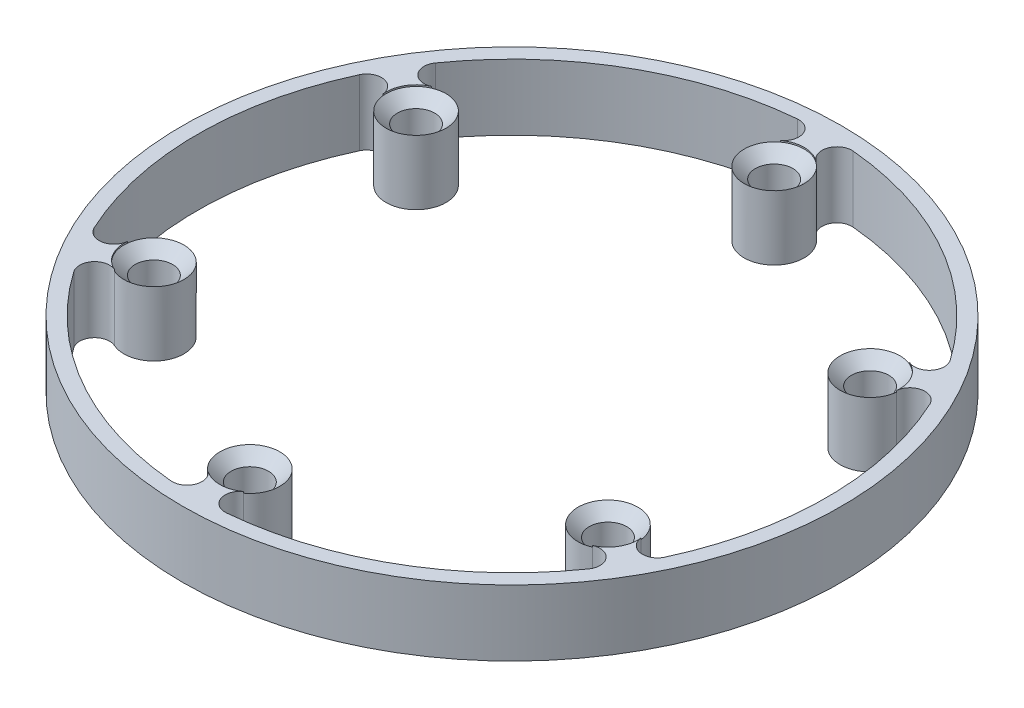
from build123d import *

# Parameters (mm, degrees)
SKETCH1_R                        = 22
BASE_SHAPE_DEPTH                 = 4.4
SPOKES_CUT_REACH                 = 33.422
SKETCH4_R                        = 1
SKETCH4_R_2                      = 2
SPOKE_FILLETS_R                  = 1
REMOVE_INNER_2_REACH             = 33.422
OUTER_M2_COUNTERSUNKS_AT_2_COUNT = 2
OUTER_M2_COUNTERSUNKS_AT_2_PITCH = 17.5
OUTER_M2_COUNTERSUNKS_AT_3_COUNT = 2
OUTER_M2_COUNTERSUNKS_AT_3_PITCH = 30.310889132
OUTER_M2_COUNTERSUNKS_AT_4_COUNT = 2
OUTER_M2_COUNTERSUNKS_AT_4_PITCH = 35
OUTER_M2_COUNTERSUNKS_AT_5_COUNT = 2
OUTER_M2_COUNTERSUNKS_AT_5_PITCH = 30.310889132
OUTER_M2_COUNTERSUNKS_AT_6_COUNT = 2
OUTER_M2_COUNTERSUNKS_AT_6_PITCH = 17.5


with BuildPart() as part:
    # Sketch1 → Base shape (new body)
    with BuildSketch(Plane(origin=(0, 0, 0), x_dir=(1, 0, 0), z_dir=(0, 1, 0))):
        Circle(SKETCH1_R)
    extrude(amount=BASE_SHAPE_DEPTH)

    # Sketch4 → Spokes cut (cut, up to next)
    with BuildSketch(Plane(origin=(0, 4.4, 0), x_dir=(1, 0, 0), z_dir=(0, 1, 0)), mode=Mode.PRIVATE) as spokes_cut_sk1:
        with BuildLine():
            Line((-0.5, 2.958039892), (-0.5, 15.563508327))
            ThreePointArc((-0.5, 15.563508327), (-1.964231018, 17.123441227), (-1.180712378, 19.114285688))
            ThreePointArc((-1.180712378, 19.114285688), (-0.835201556, 20.273782145), (-1.859621921, 20.917500001))
            ThreePointArc((-1.859621921, 20.917500001), (-10.499999965, 18.186533499), (-17.185275378, 12.069229892))
            ThreePointArc((-17.185275378, 12.069229892), (-17.140009652, 10.860196912), (-15.963100894, 10.579669712))
            ThreePointArc((-15.963100894, 10.579669712), (-13.847219636, 10.26279461), (-13.228393583, 8.214766865))
            Line((-13.228393583, 8.214766865), (-2.311737691, 1.912032648))
            ThreePointArc((-2.311737691, 1.912032648), (-1.5, 2.598076211), (-0.5, 2.958039892))
        make_face()
    spokes_cut_tool1 = extrude(spokes_cut_sk1.sketch, amount=-SPOKES_CUT_REACH, mode=Mode.PRIVATE) & part.part
    # Sketch4 → Spokes cut (cut, up to next)
    with BuildSketch(Plane(origin=(0, 4.4, 0), x_dir=(1, 0, 0), z_dir=(0, 1, 0)), mode=Mode.PRIVATE) as spokes_cut_sk2:
        with BuildLine():
            Line((0.5, 15.563508327), (0.5, 2.958039892))
            ThreePointArc((0.5, 2.958039892), (1.5, 2.598076211), (2.311737691, 1.912032648))
            Line((2.311737691, 1.912032648), (13.228393583, 8.214766865))
            ThreePointArc((13.228393583, 8.214766865), (13.847219664, 10.262794634), (15.96310096, 10.579669683))
            ThreePointArc((15.96310096, 10.579669683), (17.140009604, 10.860196854), (17.185275506, 12.06922971))
            ThreePointArc((17.185275506, 12.06922971), (10.500000061, 18.186533444), (1.859621921, 20.917500001))
            ThreePointArc((1.859621921, 20.917500001), (0.835201556, 20.273782145), (1.180712378, 19.114285688))
            ThreePointArc((1.180712378, 19.114285688), (1.964231018, 17.123441227), (0.5, 15.563508327))
        make_face()
    spokes_cut_tool2 = extrude(spokes_cut_sk2.sketch, amount=-SPOKES_CUT_REACH, mode=Mode.PRIVATE) & part.part
    # Sketch4 → Spokes cut (cut, up to next)
    with BuildSketch(Plane(origin=(0, 4.4, 0), x_dir=(1, 0, 0), z_dir=(0, 1, 0)), mode=Mode.PRIVATE) as spokes_cut_sk3:
        with BuildLine():
            ThreePointArc((-2.811737691, -1.046007244), (-3, 0), (-2.811737691, 1.046007244))
            Line((-2.811737691, 1.046007244), (-13.728393583, 7.348741462))
            ThreePointArc((-13.728393583, 7.348741462), (-15.811450636, 6.860646662), (-17.143813175, 8.534615982))
            ThreePointArc((-17.143813175, 8.534615982), (-17.975211353, 9.413585342), (-19.044897499, 8.848269844))
            ThreePointArc((-19.044897499, 8.848269844), (-21, 0), (-19.044897499, -8.848269844))
            ThreePointArc((-19.044897499, -8.848269844), (-17.975211396, -9.413585349), (-17.143813185, -8.534616069))
            ThreePointArc((-17.143813185, -8.534616069), (-15.811450677, -6.860646676), (-13.728393583, -7.348741462))
            Line((-13.728393583, -7.348741462), (-2.811737691, -1.046007244))
        make_face()
    spokes_cut_tool3 = extrude(spokes_cut_sk3.sketch, amount=-SPOKES_CUT_REACH, mode=Mode.PRIVATE) & part.part
    # Sketch4 → Spokes cut (cut, up to next)
    with BuildSketch(Plane(origin=(0, 4.4, 0), x_dir=(1, 0, 0), z_dir=(0, 1, 0)), mode=Mode.PRIVATE) as spokes_cut_sk4:
        with BuildLine():
            Line((13.728393583, 7.348741462), (2.811737691, 1.046007244))
            ThreePointArc((2.811737691, 1.046007244), (3, 0), (2.811737691, -1.046007244))
            Line((2.811737691, -1.046007244), (13.728393583, -7.348741462))
            ThreePointArc((13.728393583, -7.348741462), (15.811450607, -6.860646652), (17.143813168, -8.53461592))
            ThreePointArc((17.143813168, -8.53461592), (17.975211292, -9.413585332), (19.044897474, -8.848269898))
            ThreePointArc((19.044897474, -8.848269898), (21, -4.8e-08), (19.044897515, 8.848269811))
            ThreePointArc((19.044897515, 8.848269811), (17.975211402, 9.41358535), (17.143813182, 8.534616045))
            ThreePointArc((17.143813182, 8.534616045), (15.811450666, 6.860646672), (13.728393583, 7.348741462))
        make_face()
    spokes_cut_tool4 = extrude(spokes_cut_sk4.sketch, amount=-SPOKES_CUT_REACH, mode=Mode.PRIVATE) & part.part
    # Sketch4 → Spokes cut (cut, up to next)
    with BuildSketch(Plane(origin=(0, 4.4, 0), x_dir=(1, 0, 0), z_dir=(0, 1, 0)), mode=Mode.PRIVATE) as spokes_cut_sk5:
        with BuildLine():
            ThreePointArc((-0.5, -2.958039892), (-1.5, -2.598076211), (-2.311737691, -1.912032648))
            Line((-2.311737691, -1.912032648), (-13.228393583, -8.214766865))
            ThreePointArc((-13.228393583, -8.214766865), (-13.847219645, -10.262794618), (-15.963100915, -10.579669703))
            ThreePointArc((-15.963100915, -10.579669703), (-17.140009597, -10.860196846), (-17.185275489, -12.069229733))
            ThreePointArc((-17.185275489, -12.069229733), (-10.500000091, -18.186533427), (-1.859622018, -20.917499993))
            ThreePointArc((-1.859622018, -20.917499993), (-0.835201569, -20.27378218), (-1.180712396, -19.114285674))
            ThreePointArc((-1.180712396, -19.114285674), (-1.964231015, -17.123441216), (-0.5, -15.563508327))
            Line((-0.5, -15.563508327), (-0.5, -2.958039892))
        make_face()
    spokes_cut_tool5 = extrude(spokes_cut_sk5.sketch, amount=-SPOKES_CUT_REACH, mode=Mode.PRIVATE) & part.part
    # Sketch4 → Spokes cut (cut, up to next)
    with BuildSketch(Plane(origin=(0, 4.4, 0), x_dir=(1, 0, 0), z_dir=(0, 1, 0)), mode=Mode.PRIVATE) as spokes_cut_sk6:
        with BuildLine():
            Line((13.228393583, -8.214766865), (2.311737691, -1.912032648))
            ThreePointArc((2.311737691, -1.912032648), (1.5, -2.598076211), (0.5, -2.958039892))
            Line((0.5, -2.958039892), (0.5, -15.563508327))
            ThreePointArc((0.5, -15.563508327), (1.96423102, -17.123441238), (1.18071236, -19.114285701))
            ThreePointArc((1.18071236, -19.114285701), (0.835201555, -20.273782143), (1.859621893, -20.917500004))
            ThreePointArc((1.859621893, -20.917500004), (10.499999953, -18.186533507), (17.185275378, -12.069229892))
            ThreePointArc((17.185275378, -12.069229892), (17.140009606, -10.860196857), (15.963100764, -10.57966977))
            ThreePointArc((15.963100764, -10.57966977), (13.847219583, -10.262794564), (13.228393583, -8.214766865))
        make_face()
    spokes_cut_tool6 = extrude(spokes_cut_sk6.sketch, amount=-SPOKES_CUT_REACH, mode=Mode.PRIVATE) & part.part
    # Sketch4 → Spokes cut (cut, up to next)
    with BuildSketch(Plane(origin=(0, 4.4, 0), x_dir=(1, 0, 0), z_dir=(0, 1, 0)), mode=Mode.PRIVATE) as spokes_cut_sk7:
        with Locations((0, 17.5)):
            Circle(SKETCH4_R)
    spokes_cut_tool7 = extrude(spokes_cut_sk7.sketch, amount=-SPOKES_CUT_REACH, mode=Mode.PRIVATE) & part.part
    # Sketch4 → Spokes cut (cut, up to next)
    with BuildSketch(Plane(origin=(0, 4.4, 0), x_dir=(1, 0, 0), z_dir=(0, 1, 0)), mode=Mode.PRIVATE) as spokes_cut_sk8:
        Circle(SKETCH4_R_2)
    spokes_cut_tool8 = extrude(spokes_cut_sk8.sketch, amount=-SPOKES_CUT_REACH, mode=Mode.PRIVATE) & part.part
    # Sketch4 → Spokes cut (cut, up to next)
    with BuildSketch(Plane(origin=(0, 4.4, 0), x_dir=(1, 0, 0), z_dir=(0, 1, 0)), mode=Mode.PRIVATE) as spokes_cut_sk9:
        with Locations((15.155444566, 8.75)):
            Circle(SKETCH4_R)
    spokes_cut_tool9 = extrude(spokes_cut_sk9.sketch, amount=-SPOKES_CUT_REACH, mode=Mode.PRIVATE) & part.part
    # Sketch4 → Spokes cut (cut, up to next)
    with BuildSketch(Plane(origin=(0, 4.4, 0), x_dir=(1, 0, 0), z_dir=(0, 1, 0)), mode=Mode.PRIVATE) as spokes_cut_sk10:
        with Locations((15.155444566, -8.75)):
            Circle(SKETCH4_R)
    spokes_cut_tool10 = extrude(spokes_cut_sk10.sketch, amount=-SPOKES_CUT_REACH, mode=Mode.PRIVATE) & part.part
    # Sketch4 → Spokes cut (cut, up to next)
    with BuildSketch(Plane(origin=(0, 4.4, 0), x_dir=(1, 0, 0), z_dir=(0, 1, 0)), mode=Mode.PRIVATE) as spokes_cut_sk11:
        with Locations((0, -17.5)):
            Circle(SKETCH4_R)
    spokes_cut_tool11 = extrude(spokes_cut_sk11.sketch, amount=-SPOKES_CUT_REACH, mode=Mode.PRIVATE) & part.part
    # Sketch4 → Spokes cut (cut, up to next)
    with BuildSketch(Plane(origin=(0, 4.4, 0), x_dir=(1, 0, 0), z_dir=(0, 1, 0)), mode=Mode.PRIVATE) as spokes_cut_sk12:
        with Locations((-15.155444566, -8.75)):
            Circle(SKETCH4_R)
    spokes_cut_tool12 = extrude(spokes_cut_sk12.sketch, amount=-SPOKES_CUT_REACH, mode=Mode.PRIVATE) & part.part
    # Sketch4 → Spokes cut (cut, up to next)
    with BuildSketch(Plane(origin=(0, 4.4, 0), x_dir=(1, 0, 0), z_dir=(0, 1, 0)), mode=Mode.PRIVATE) as spokes_cut_sk13:
        with Locations((-15.155444566, 8.75)):
            Circle(SKETCH4_R)
    spokes_cut_tool13 = extrude(spokes_cut_sk13.sketch, amount=-SPOKES_CUT_REACH, mode=Mode.PRIVATE) & part.part
    add(spokes_cut_tool1.solids().sort_by_distance((-6.882593, 4.4, -11.921001))[0], mode=Mode.SUBTRACT)
    add(spokes_cut_tool2.solids().sort_by_distance((6.882593, 4.4, -11.921001))[0], mode=Mode.SUBTRACT)
    add(spokes_cut_tool3.solids().sort_by_distance((-13.765186, 4.4, 0))[0], mode=Mode.SUBTRACT)
    add(spokes_cut_tool4.solids().sort_by_distance((13.765186, 4.4, 0))[0], mode=Mode.SUBTRACT)
    add(spokes_cut_tool5.solids().sort_by_distance((-6.882593, 4.4, 11.921001))[0], mode=Mode.SUBTRACT)
    add(spokes_cut_tool6.solids().sort_by_distance((6.882593, 4.4, 11.921001))[0], mode=Mode.SUBTRACT)
    add(spokes_cut_tool7.solids().sort_by_distance((0, 4.4, -17.5))[0], mode=Mode.SUBTRACT)
    add(spokes_cut_tool8.solids().sort_by_distance((0, 4.4, 0))[0], mode=Mode.SUBTRACT)
    add(spokes_cut_tool9.solids().sort_by_distance((15.155445, 4.4, -8.75))[0], mode=Mode.SUBTRACT)
    add(spokes_cut_tool10.solids().sort_by_distance((15.155445, 4.4, 8.75))[0], mode=Mode.SUBTRACT)
    add(spokes_cut_tool11.solids().sort_by_distance((0, 4.4, 17.5))[0], mode=Mode.SUBTRACT)
    add(spokes_cut_tool12.solids().sort_by_distance((-15.155445, 4.4, 8.75))[0], mode=Mode.SUBTRACT)
    add(spokes_cut_tool13.solids().sort_by_distance((-15.155445, 4.4, -8.75))[0], mode=Mode.SUBTRACT)

    # Spoke fillets
    spoke_fillets_edges = [part.edges().sort_by_distance(p)[0] for p in [
        (13.228393583, 2.2, 8.214766865),
        (0.5, 2.2, 2.958039892),
        (13.728393583, 2.2, -7.348741462),
        (-0.5, 2.2, -2.958039892),
        (13.228393583, 2.2, -8.214766865),
        (0.5, 2.2, -2.958039892),
        (2.811737691, 2.2, 1.046007244),
        (0.5, 2.2, -15.563508327),
        (-13.228393583, 2.2, 8.214766865),
        (0.5, 2.2, 15.563508327),
        (2.311737691, 2.2, 1.912032648),
        (-0.5, 2.2, 2.958039892),
        (-0.5, 2.2, -15.563508327),
        (-0.5, 2.2, 15.563508327),
        (13.728393583, 2.2, 7.348741462),
        (2.311737691, 2.2, -1.912032648),
        (-2.811737691, 2.2, 1.046007244),
        (-13.728393583, 2.2, 7.348741462),
        (-2.311737691, 2.2, -1.912032648),
        (-13.228393583, 2.2, -8.214766865),
        (-13.728393583, 2.2, -7.348741462),
        (-2.811737691, 2.2, -1.046007244),
        (2.811737691, 2.2, -1.046007244),
    ]]
    fillet(spoke_fillets_edges, radius=SPOKE_FILLETS_R)

    # Sketch10 → Remove inner 2 (cut, up to next)
    with BuildSketch(Plane(origin=(0, 4.4, 0), x_dir=(1, 0, 0), z_dir=(0, 1, 0)), mode=Mode.PRIVATE) as remove_inner_2_sk1:
        with BuildLine():
            ThreePointArc((-14.058104222, 10.4220778), (-13.395518334, 9.700084026), (-13.155444566, 8.75))
            ThreePointArc((-13.155444566, 8.75), (-14.106345753, 7.047239982), (-16.054836246, 6.963636486))
            ThreePointArc((-16.054836246, 6.963636486), (-17.5, 0), (-16.054836246, -6.963636486))
            ThreePointArc((-16.054836246, -6.963636486), (-14.106345753, -7.047239982), (-13.155444566, -8.75))
            ThreePointArc((-13.155444566, -8.75), (-13.395518334, -9.700084026), (-14.058104222, -10.4220778))
            ThreePointArc((-14.058104222, -10.4220778), (-8.75, -15.155444566), (-1.996732024, -17.385714286))
            ThreePointArc((-1.996732024, -17.385714286), (0, -15.5), (1.996732024, -17.385714286))
            ThreePointArc((1.996732024, -17.385714286), (8.75, -15.155444566), (14.058104222, -10.4220778))
            ThreePointArc((14.058104222, -10.4220778), (13.423393759, -7.75), (16.054836246, -6.963636486))
            ThreePointArc((16.054836246, -6.963636486), (17.134900559, -3.556006587), (17.5, 0))
            ThreePointArc((17.5, 0), (17.134900559, 3.556006587), (16.054836246, 6.963636486))
            ThreePointArc((16.054836246, 6.963636486), (13.423393759, 7.75), (14.058104222, 10.4220778))
            ThreePointArc((14.058104222, 10.4220778), (8.75, 15.155444566), (1.996732024, 17.385714286))
            ThreePointArc((1.996732024, 17.385714286), (0, 15.5), (-1.996732024, 17.385714286))
            ThreePointArc((-1.996732024, 17.385714286), (-8.75, 15.155444566), (-14.058104222, 10.4220778))
        make_face()
    remove_inner_2_tool1 = extrude(remove_inner_2_sk1.sketch, amount=-REMOVE_INNER_2_REACH, mode=Mode.PRIVATE) & part.part
    add(remove_inner_2_tool1.solids().sort_by_distance((0, 4.4, 0))[0], mode=Mode.SUBTRACT)

    # Sketch8 → Outer M2 countersunks (revolve, cut)
    with BuildSketch(Plane(origin=(-15.155444566, 4.4, -8.75), x_dir=(0, 0, 1), z_dir=(1, 0, 0))):
        Polygon((0, 0), (0, 4.4), (1.25, 4.4), (1.25, 0.85), (2, 0.1), (2, 0), align=None)
    outer_m2_countersunks = revolve(axis=Axis((-15.155444566, 10.75, -8.75), (0, -1, 0)), mode=Mode.SUBTRACT)

    # Outer M2 countersunks at 2: Outer M2 countersunks ×2
    with Locations(*[Vector(0.8660254037844386, 0, -0.5000000000000003) * (i * OUTER_M2_COUNTERSUNKS_AT_2_PITCH) for i in range(1, OUTER_M2_COUNTERSUNKS_AT_2_COUNT)]):
        add(outer_m2_countersunks, mode=Mode.SUBTRACT)

    # Outer M2 countersunks at 3: Outer M2 countersunks ×2
    with Locations(*[(i * OUTER_M2_COUNTERSUNKS_AT_3_PITCH, 0, 0) for i in range(1, OUTER_M2_COUNTERSUNKS_AT_3_COUNT)]):
        add(outer_m2_countersunks, mode=Mode.SUBTRACT)

    # Outer M2 countersunks at 4: Outer M2 countersunks ×2
    with Locations(*[Vector(0.8660254037844389, 0, 0.4999999999999996) * (i * OUTER_M2_COUNTERSUNKS_AT_4_PITCH) for i in range(1, OUTER_M2_COUNTERSUNKS_AT_4_COUNT)]):
        add(outer_m2_countersunks, mode=Mode.SUBTRACT)

    # Outer M2 countersunks at 5: Outer M2 countersunks ×2
    with Locations(*[Vector(0.5000000000000004, 0, 0.8660254037844384) * (i * OUTER_M2_COUNTERSUNKS_AT_5_PITCH) for i in range(1, OUTER_M2_COUNTERSUNKS_AT_5_COUNT)]):
        add(outer_m2_countersunks, mode=Mode.SUBTRACT)

    # Outer M2 countersunks at 6: Outer M2 countersunks ×2
    with Locations(*[(0, 0, i * OUTER_M2_COUNTERSUNKS_AT_6_PITCH) for i in range(1, OUTER_M2_COUNTERSUNKS_AT_6_COUNT)]):
        add(outer_m2_countersunks, mode=Mode.SUBTRACT)


solid = part.part
